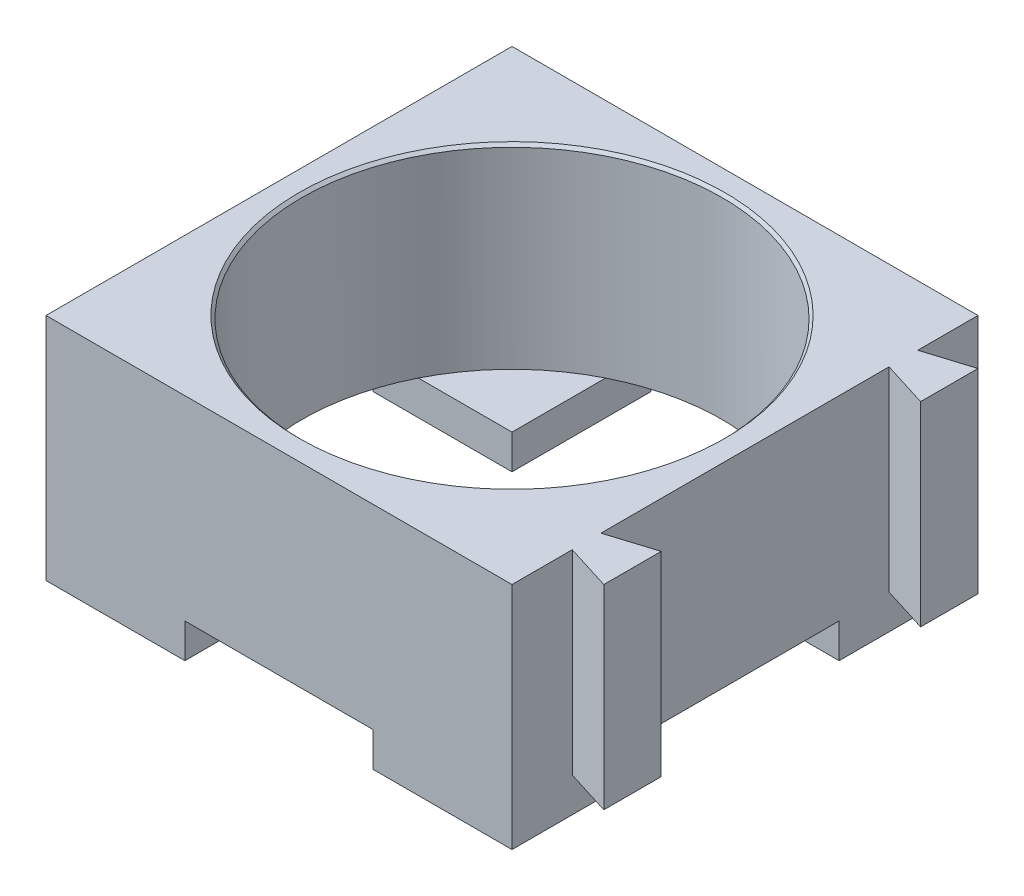
from build123d import *

# Parameters (mm, degrees)
SKETCH1_R              = 9.15
CELL_HOLDER_DEPTH      = 8.5
SKETCH2_W              = 6.05
SKETCH2_H              = 6.05
BOTTOM_BASE_BOSS_DEPTH = 1.5
CHAMFER1_SIZE          = 0.125


with BuildPart() as part:
    # Sketch1 → Cell Holder (new body)
    with BuildSketch(Plane(origin=(0, 0, 0), x_dir=(1, 0, 0), z_dir=(0, 1, 0))):
        Polygon((12.15, 8.15), (12.15, 5.65), (10.15, 6.275), (10.15, -6.275), (12.15, -5.65), (12.15, -8.15), (10.15, -7.525), (10.15, -10.15), (-10.15, -10.15), (-10.15, 10.15), (10.15, 10.15), (10.15, 7.525), align=None)
        Circle(SKETCH1_R, mode=Mode.SUBTRACT)
    extrude(amount=CELL_HOLDER_DEPTH)

    # Sketch2 → Bottom Base Boss (add)
    with BuildSketch(Plane.XZ):
        with Locations((-7.125, 7.125)):
            Rectangle(SKETCH2_W, SKETCH2_H)
        with Locations((-7.125, -7.125)):
            Rectangle(SKETCH2_W, SKETCH2_H)
        with Locations((7.125, 7.125)):
            Rectangle(SKETCH2_W, SKETCH2_H)
        with Locations((7.125, -7.125)):
            Rectangle(SKETCH2_W, SKETCH2_H)
    extrude(amount=BOTTOM_BASE_BOSS_DEPTH)

    # Chamfer1
    chamfer1_edges = [part.edges().sort_by_distance(p)[0] for p in [
        (-9.15, 8.5, 0),
    ]]
    chamfer(chamfer1_edges, length=CHAMFER1_SIZE)


solid = part.part
